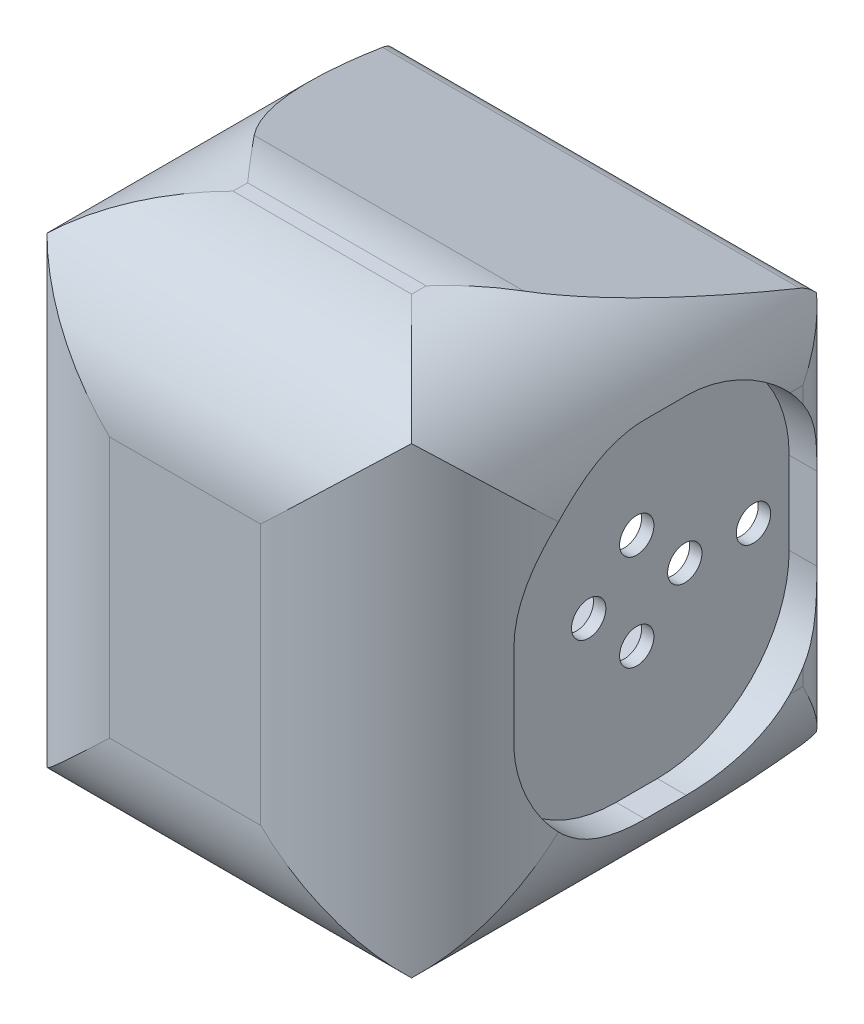
from build123d import *
from OCP.BRepAlgoAPI import BRepAlgoAPI_Cut
from OCP.TopTools import TopTools_ListOfShape

# Parameters (mm, degrees)
BOSS_1_DEPTH    = 66
BOSS_2_DEPTH    = 5.25
CUT_3_DEPTH     = 80
CUT_4_DEPTH     = 80
CUT_5_DEPTH     = 80
CUT_6_DEPTH     = 80
CUT_7_DEPTH     = 62.2
CUT_8_DEPTH     = 62.2
CUT_9_DEPTH     = 62.2
CUT_10_DEPTH    = 62.2
CUT_11_DEPTH    = 6.2
S_HOLE12_R      = 2.5
HOLE_12_DEPTH   = 2
S_CUT13_W       = 52
S_CUT13_H       = 48
POCKET_13_DEPTH = 16.2
S_CUT14_W       = 52
S_CUT14_H       = 60
POCKET_14_DEPTH = 36
S_CUT15_W       = 36
S_CUT15_H       = 48
POCKET_15_DEPTH = 6.1
S_CUT16_W       = 7.2
S_CUT16_H       = 32
POCKET_16_DEPTH = 28
S_HOLE17_R      = 2.5
HOLE_17_DEPTH   = 7.2
S_HOLE18_R      = 2.5
HOLE_18_DEPTH   = 7.2
S_HOLE19_R      = 2.5
HOLE_19_DEPTH   = 7.2
S_HOLE20_R      = 2.5
HOLE_20_DEPTH   = 7.2
S_HOLE21_R      = 1.2
HOLE_21_DEPTH   = 7.2
S_HOLE22_R      = 2.3
HOLE_22_DEPTH   = 2
S_HOLE23_R      = 1.2
HOLE_23_DEPTH   = 7.2
S_HOLE24_R      = 2.3
HOLE_24_DEPTH   = 2


with BuildPart() as part:
    # S_prism1 → Boss_1 (new body)
    with BuildSketch(Plane(origin=(-33, 0, 0), x_dir=(0, 0, -1), z_dir=(1, 0, 0))):
        with BuildLine():
            Line((0, -25.0397), (0, 25.0397))
            ThreePointArc((0, 25.0397), (-0.784802451, 27.419203311), (-2.8311, 28.8651))
            Line((-2.8311, 28.8651), (-32.2859, 37.8651))
            ThreePointArc((-32.2859, 37.8651), (-36.042603994, 38.714700597), (-39.8836, 39))
            Line((-39.8836, 39), (-42, 39))
            ThreePointArc((-42, 39), (-56.1421, 33.1421), (-62, 19))
            Line((-62, 19), (-62, -19))
            ThreePointArc((-62, -19), (-56.1421, -33.1421), (-42, -39))
            Line((-42, -39), (-39.8836, -39))
            ThreePointArc((-39.8836, -39), (-36.042603994, -38.714700597), (-32.2859, -37.8651))
            Line((-32.2859, -37.8651), (-2.8311, -28.8651))
            ThreePointArc((-2.8311, -28.8651), (-0.784802451, -27.419203311), (0, -25.0397))
        make_face()
    extrude(amount=BOSS_1_DEPTH)

    # S_prism2 → Boss_2 (add)
    with BuildSketch(Plane(origin=(27.75, 0, 0), x_dir=(0, 0, -1), z_dir=(1, 0, 0))):
        with BuildLine():
            Line((-12.2, -6), (-12.2, 6))
            ThreePointArc((-12.2, 6), (-14.7775, 12.2225), (-21, 14.8))
            Line((-21, 14.8), (-27, 14.8))
            ThreePointArc((-27, 14.8), (-33.2225, 12.2225), (-35.8, 6))
            Line((-35.8, 6), (-35.8, -6))
            ThreePointArc((-35.8, -6), (-33.2225, -12.2225), (-27, -14.8))
            Line((-27, -14.8), (-21, -14.8))
            ThreePointArc((-21, -14.8), (-14.7775, -12.2225), (-12.2, -6))
        make_face()
    extrude(amount=BOSS_2_DEPTH)

    # S_pcut3 → Cut_3 (cut)
    with BuildSketch(Plane(origin=(0, -40, 0), x_dir=(1, 0, 0), z_dir=(0, 1, 0))):
        with BuildLine():
            Line((33.6, -62.6), (11, -62.6))
            Line((11, -62.6), (11, -62))
            ThreePointArc((11, -62), (26.5563, -55.5563), (33, -40))
            Line((33, -40), (33.6, -40))
            Line((33.6, -40), (33.6, -62.6))
        make_face()
    extrude(amount=CUT_3_DEPTH, mode=Mode.SUBTRACT)

    # S_pcut4 → Cut_4 (cut)
    with BuildSketch(Plane(origin=(0, -40, 0), x_dir=(1, 0, 0), z_dir=(0, 1, 0))):
        with BuildLine():
            Line((-33.6, -62.6), (-11, -62.6))
            Line((-11, -62.6), (-11, -62))
            ThreePointArc((-11, -62), (-26.5563, -55.5563), (-33, -40))
            Line((-33, -40), (-33.6, -40))
            Line((-33.6, -40), (-33.6, -62.6))
        make_face()
    extrude(amount=CUT_4_DEPTH, mode=Mode.SUBTRACT)

    # S_pcut5 → Cut_5 (cut)
    with BuildSketch(Plane(origin=(0, -40, 0), x_dir=(1, 0, 0), z_dir=(0, 1, 0))):
        with BuildLine():
            Line((33.6, 0.6), (28, 0.6))
            Line((28, 0.6), (28, 0))
            ThreePointArc((28, 0), (31.5355, -1.4645), (33, -5))
            Line((33, -5), (33.6, -5))
            Line((33.6, -5), (33.6, 0.6))
        make_face()
    extrude(amount=CUT_5_DEPTH, mode=Mode.SUBTRACT)

    # S_pcut6 → Cut_6 (cut)
    with BuildSketch(Plane(origin=(0, -40, 0), x_dir=(1, 0, 0), z_dir=(0, 1, 0))):
        with BuildLine():
            Line((-33.6, 0.6), (-28, 0.6))
            Line((-28, 0.6), (-28, 0))
            ThreePointArc((-28, 0), (-31.5355, -1.4645), (-33, -5))
            Line((-33, -5), (-33.6, -5))
            Line((-33.6, -5), (-33.6, 0.6))
        make_face()
    extrude(amount=CUT_6_DEPTH, mode=Mode.SUBTRACT)

    # S_pcut7 → Cut_7 (cut)
    with BuildSketch(Plane.XY.offset(-0.1)):
        with BuildLine():
            Line((33.6, 39.6), (13, 39.6))
            Line((13, 39.6), (13, 39))
            ThreePointArc((13, 39), (27.1421, 33.1421), (33, 19))
            Line((33, 19), (33.6, 19))
            Line((33.6, 19), (33.6, 39.6))
        make_face()
    extrude(amount=CUT_7_DEPTH, mode=Mode.SUBTRACT)

    # S_pcut8 → Cut_8 (cut)
    with BuildSketch(Plane.XY.offset(-0.1)):
        with BuildLine():
            Line((33.6, -39.6), (13, -39.6))
            Line((13, -39.6), (13, -39))
            ThreePointArc((13, -39), (27.1421, -33.1421), (33, -19))
            Line((33, -19), (33.6, -19))
            Line((33.6, -19), (33.6, -39.6))
        make_face()
    extrude(amount=CUT_8_DEPTH, mode=Mode.SUBTRACT)

    # S_pcut9 → Cut_9 (cut)
    with BuildSketch(Plane.XY.offset(-0.1)):
        with BuildLine():
            Line((-33.6, 39.6), (-13, 39.6))
            Line((-13, 39.6), (-13, 39))
            ThreePointArc((-13, 39), (-27.1421, 33.1421), (-33, 19))
            Line((-33, 19), (-33.6, 19))
            Line((-33.6, 19), (-33.6, 39.6))
        make_face()
    extrude(amount=CUT_9_DEPTH, mode=Mode.SUBTRACT)

    # S_pcut10 → Cut_10 (cut)
    with BuildSketch(Plane.XY.offset(-0.1)):
        with BuildLine():
            Line((-33.6, -39.6), (-13, -39.6))
            Line((-13, -39.6), (-13, -39))
            ThreePointArc((-13, -39), (-27.1421, -33.1421), (-33, -19))
            Line((-33, -19), (-33.6, -19))
            Line((-33.6, -19), (-33.6, -39.6))
        make_face()
    extrude(amount=CUT_10_DEPTH, mode=Mode.SUBTRACT)


with BuildPart() as cut_11_tool:
    # S_pcut11 → Cut_11 (new body)
    with BuildSketch(Plane(origin=(27.8, 0, 0), x_dir=(0, 0, -1), z_dir=(1, 0, 0))):
        with BuildLine():
            Line((-1.8, -6), (-1.8, 6))
            ThreePointArc((-1.8, 6), (-7.4235, 19.5765), (-21, 25.2))
            Line((-21, 25.2), (-27, 25.2))
            ThreePointArc((-27, 25.2), (-40.5765, 19.5765), (-46.2, 6))
            Line((-46.2, 6), (-46.2, -6))
            ThreePointArc((-46.2, -6), (-40.5765, -19.5765), (-27, -25.2))
            Line((-27, -25.2), (-21, -25.2))
            ThreePointArc((-21, -25.2), (-7.4235, -19.5765), (-1.8, -6))
        make_face()
    extrude(amount=CUT_11_DEPTH)


with BuildPart() as part_1:
    add(part.part)

    # Cut_11: cut by cut_11_tool, with a tolerance
    cut_11_stock = TopTools_ListOfShape()
    cut_11_stock.Append(part_1.part.wrapped)
    cut_11_tools = TopTools_ListOfShape()
    cut_11_tools.Append(cut_11_tool.part.wrapped)
    cut_11_cut = BRepAlgoAPI_Cut()
    cut_11_cut.SetArguments(cut_11_stock)
    cut_11_cut.SetTools(cut_11_tools)
    cut_11_cut.SetFuzzyValue(0.00001)
    cut_11_cut.Build()
    add(Compound.cast(cut_11_cut.Shape()).solids(), mode=Mode.REPLACE)

    # S_hole12 → Hole_12 (cut)
    with BuildSketch(Plane(origin=(25.9, 0, 0), x_dir=(0, 0, -1), z_dir=(1, 0, 0))):
        with Locations((-7, 0)):
            Circle(S_HOLE12_R)
    extrude(amount=HOLE_12_DEPTH, mode=Mode.SUBTRACT)

    # S_cut13 → Pocket_13 (cut)
    with BuildSketch(Plane.XY.offset(-0.1)):
        Rectangle(S_CUT13_W, S_CUT13_H)
    extrude(amount=POCKET_13_DEPTH, mode=Mode.SUBTRACT)

    # S_cut14 → Pocket_14 (cut)
    with BuildSketch(Plane.XY.offset(16)):
        Rectangle(S_CUT14_W, S_CUT14_H)
    extrude(amount=POCKET_14_DEPTH, mode=Mode.SUBTRACT)

    # S_cut15 → Pocket_15 (cut)
    with BuildSketch(Plane.XY.offset(51.9)):
        Rectangle(S_CUT15_W, S_CUT15_H)
    extrude(amount=POCKET_15_DEPTH, mode=Mode.SUBTRACT)

    # S_cut16 → Pocket_16 (cut)
    with BuildSketch(Plane.XY.offset(16)):
        with Locations((-29.5, 0)):
            Rectangle(S_CUT16_W, S_CUT16_H)
    extrude(amount=POCKET_16_DEPTH, mode=Mode.SUBTRACT)

    # S_hole17 → Hole_17 (cut)
    with BuildSketch(Plane(origin=(25.9, 0, 0), x_dir=(0, 0, -1), z_dir=(1, 0, 0))):
        with Locations((-31, 0)):
            Circle(S_HOLE17_R)
    extrude(amount=HOLE_17_DEPTH, mode=Mode.SUBTRACT)

    # S_hole18 → Hole_18 (cut)
    with BuildSketch(Plane(origin=(25.9, 0, 0), x_dir=(0, 0, -1), z_dir=(1, 0, 0))):
        with Locations((-24, 7)):
            Circle(S_HOLE18_R)
    extrude(amount=HOLE_18_DEPTH, mode=Mode.SUBTRACT)

    # S_hole19 → Hole_19 (cut)
    with BuildSketch(Plane(origin=(25.9, 0, 0), x_dir=(0, 0, -1), z_dir=(1, 0, 0))):
        with Locations((-24, -7)):
            Circle(S_HOLE19_R)
    extrude(amount=HOLE_19_DEPTH, mode=Mode.SUBTRACT)

    # S_hole20 → Hole_20 (cut)
    with BuildSketch(Plane(origin=(25.9, 0, 0), x_dir=(0, 0, -1), z_dir=(1, 0, 0))):
        with Locations((-17, 0)):
            Circle(S_HOLE20_R)
    extrude(amount=HOLE_20_DEPTH, mode=Mode.SUBTRACT)

    # S_hole21 → Hole_21 (cut)
    with BuildSketch(Plane(origin=(-33.1, 0, 0), x_dir=(0, 0, -1), z_dir=(1, 0, 0))):
        with Locations((-8, -10)):
            Circle(S_HOLE21_R)
    extrude(amount=HOLE_21_DEPTH, mode=Mode.SUBTRACT)

    # S_hole22 → Hole_22 (cut)
    with BuildSketch(Plane(origin=(-33.1, 0, 0), x_dir=(0, 0, -1), z_dir=(1, 0, 0))):
        with Locations((-8, -10)):
            Circle(S_HOLE22_R)
    extrude(amount=HOLE_22_DEPTH, mode=Mode.SUBTRACT)

    # S_hole23 → Hole_23 (cut)
    with BuildSketch(Plane(origin=(-33.1, 0, 0), x_dir=(0, 0, -1), z_dir=(1, 0, 0))):
        with Locations((-8, 10)):
            Circle(S_HOLE23_R)
    extrude(amount=HOLE_23_DEPTH, mode=Mode.SUBTRACT)

    # S_hole24 → Hole_24 (cut)
    with BuildSketch(Plane(origin=(-33.1, 0, 0), x_dir=(0, 0, -1), z_dir=(1, 0, 0))):
        with Locations((-8, 10)):
            Circle(S_HOLE24_R)
    extrude(amount=HOLE_24_DEPTH, mode=Mode.SUBTRACT)


solid = part_1.part
